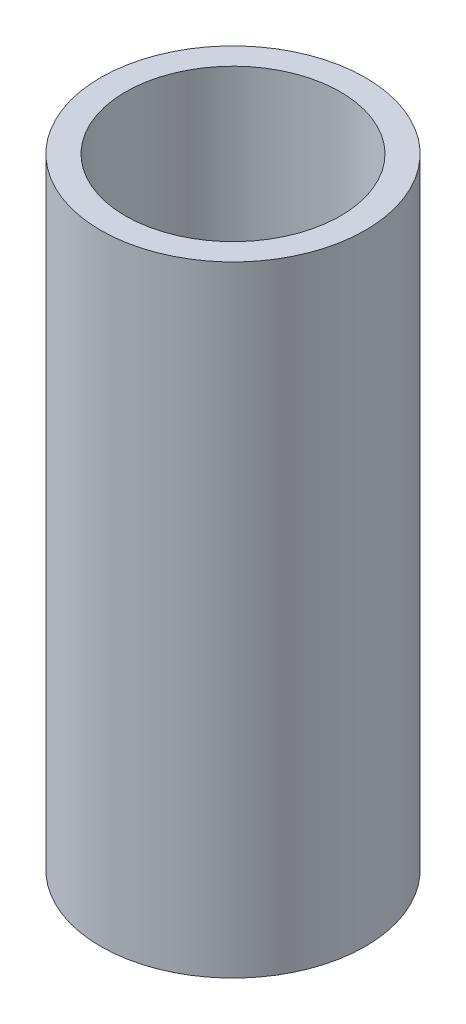
from build123d import *

# Parameters (mm, degrees)
SKETCH1_R           = 17.5
BOSS_EXTRUDE1_DEPTH = 82.0234872
SKETCH2_R           = 14.215215699
CUT_EXTRUDE1_DEPTH  = 86.675856882


with BuildPart() as part:
    # Sketch1 → Boss-Extrude1 (new body)
    with BuildSketch(Plane(origin=(0, 0, 0), x_dir=(1, 0, 0), z_dir=(0, 1, 0))):
        Circle(SKETCH1_R)
    extrude(amount=BOSS_EXTRUDE1_DEPTH)

    # Sketch2 → Cut-Extrude1 (cut, through all)
    with BuildSketch(Plane(origin=(0, 0, 0), x_dir=(1, 0, 0), z_dir=(0, 1, 0))):
        Circle(SKETCH2_R)
    extrude(amount=CUT_EXTRUDE1_DEPTH, mode=Mode.SUBTRACT)


solid = part.part
